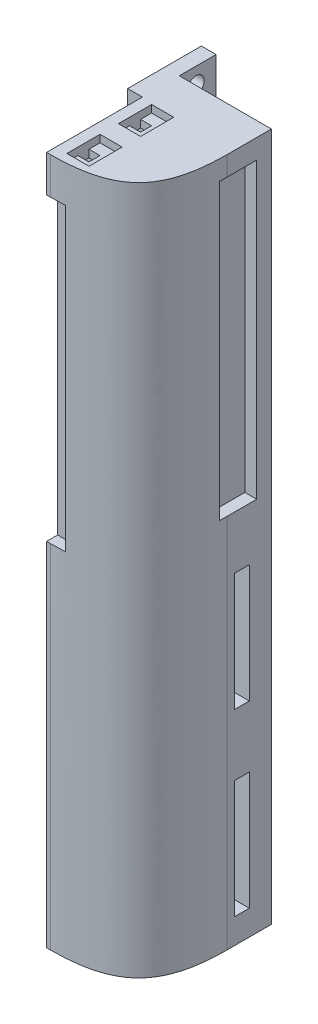
from build123d import *

# Parameters (mm, degrees)
SKETCH1_W                = 25
SKETCH1_H                = 36
BOSS_EXTRUDE1_DEPTH      = 186.9
FILLET1_SIZE             = 24
SKETCH2_W                = 5
SKETCH2_H                = 81.4
CUT_EXTRUDE1_DEPTH       = 3
BOSS_EXTRUDE3_DEPTH      = 10
BOSS_EXTRUDE3_DEPTH_BACK = 10
SKETCH6_W                = 4
SKETCH6_H                = 10
CUT_EXTRUDE2_REACH       = 196.65
SKETCH7_R                = 2.25
CHAMFER1_SIZE            = 4
SKETCH8_W                = 6
SKETCH8_H                = 4
CUT_EXTRUDE3_DEPTH       = 9
SKETCH9_W                = 3
SKETCH9_H                = 3
CUT_EXTRUDE4_DEPTH       = 10
BOSS_EXTRUDE4_DEPTH      = 4
SKETCH11_R               = 2
CUT_EXTRUDE5_DEPTH       = 5
SKETCH14_R               = 1.5
CUT_EXTRUDE6_DEPTH       = 4
SKETCH15_W               = 4
SKETCH15_H               = 32
CUT_EXTRUDE7_DEPTH       = 4
SKETCH16_W               = 10
SKETCH16_H               = 79.7
CUT_EXTRUDE8_DEPTH       = 3.2
SKETCH17_W               = 6
SKETCH17_H               = 9
CUT_EXTRUDE9_DEPTH       = 2


# Some blends are built 0.0001 mm under size
with BuildPart() as part:
    # Sketch1 → Boss-Extrude1 (new body)
    with BuildSketch(Plane(origin=(0, 0, 0), x_dir=(1, 0, 0), z_dir=(0, 1, 0))):
        with Locations((12.5, 18)):
            Rectangle(SKETCH1_W, SKETCH1_H)
    extrude(amount=BOSS_EXTRUDE1_DEPTH)

    # Fillet1
    # a fillet whose section is not a circle: 24 mm, written as the material it takes off along each edge
    with BuildSketch(Plane(origin=(25, -60, 0), x_dir=(-1, 0, 0), z_dir=(0, 1, 0))) as fillet1_piece_1:
        with BuildLine():
            Bezier((FILLET1_SIZE, 0), (0, 0), (0, -FILLET1_SIZE), weights=[1, 1.222222222, 1])
            Line((0, -FILLET1_SIZE), (0, 0))
            Line((0, 0), (FILLET1_SIZE, 0))
        make_face()
    extrude(amount=306.9, mode=Mode.SUBTRACT)

    # Sketch2 → Cut-Extrude1 (cut)
    with BuildSketch(Plane(origin=(0, 0, 0), x_dir=(-1, 0, 0), z_dir=(0, 0, -1))):
        with Locations((-2.5, 136.2)):
            Rectangle(SKETCH2_W, SKETCH2_H)
    extrude(amount=CUT_EXTRUDE1_DEPTH, mode=Mode.SUBTRACT)

    # Sketch6 → Boss-Extrude3 (add, two sides: drawn at the far end of the back side and taken through both)
    with BuildSketch(Plane(origin=(0, 0, -36), x_dir=(-1, 0, 0), z_dir=(0, 0, -1)).offset(-BOSS_EXTRUDE3_DEPTH_BACK)):
        with Locations((2, 181.9)):
            Rectangle(SKETCH6_W, SKETCH6_H)
        with Locations((2, 71.9)):
            Rectangle(SKETCH6_W, SKETCH6_H)
    extrude(amount=BOSS_EXTRUDE3_DEPTH + BOSS_EXTRUDE3_DEPTH_BACK)

    # Sketch7 → Cut-Extrude2 (cut, up to next)
    with BuildSketch(Plane.ZY.offset(4), mode=Mode.PRIVATE) as cut_extrude2_sk1:
        with Locations(Location((-40.5, 182.4, 0), (0, 0, 270))):
            Circle(SKETCH7_R)
    cut_extrude2_tool1 = extrude(cut_extrude2_sk1.sketch, amount=-CUT_EXTRUDE2_REACH, mode=Mode.PRIVATE) & part.part
    # Sketch7 → Cut-Extrude2 (cut, up to next)
    with BuildSketch(Plane.ZY.offset(4), mode=Mode.PRIVATE) as cut_extrude2_sk2:
        with Locations(Location((-40.5, 71.4, 0), (0, 0, 270))):
            Circle(SKETCH7_R)
    cut_extrude2_tool2 = extrude(cut_extrude2_sk2.sketch, amount=-CUT_EXTRUDE2_REACH, mode=Mode.PRIVATE) & part.part
    add(cut_extrude2_tool1.solids().sort_by_distance((-4, 182.4, -40.5))[0], mode=Mode.SUBTRACT)
    add(cut_extrude2_tool2.solids().sort_by_distance((-4, 71.4, -40.5))[0], mode=Mode.SUBTRACT)

    # Chamfer1
    chamfer1_edges = [part.edges().sort_by_distance(p)[0] for p in [
        (0, 71.9, -26),
    ]]
    chamfer(chamfer1_edges, length=CHAMFER1_SIZE - 0.0001)  # a hair under: the kernel refuses the full size

    # Sketch8 → Cut-Extrude3 (cut)
    with BuildSketch(Plane.ZY):
        with Locations((-7, 180.9)):
            Rectangle(SKETCH8_W, SKETCH8_H)
        with Locations((-21, 180.9)):
            Rectangle(SKETCH8_W, SKETCH8_H)
    extrude(amount=-CUT_EXTRUDE3_DEPTH, mode=Mode.SUBTRACT)

    # Sketch9 → Cut-Extrude4 (cut)
    with BuildSketch(Plane(origin=(0, 186.9, 0), x_dir=(1, 0, 0), z_dir=(0, 1, 0))):
        with Locations((4.5, 7)):
            Rectangle(SKETCH9_W, SKETCH9_H)
        with Locations((4.5, 21)):
            Rectangle(SKETCH9_W, SKETCH9_H)
    extrude(amount=-CUT_EXTRUDE4_DEPTH, mode=Mode.SUBTRACT)

    # Sketch10 → Boss-Extrude4 (add)
    with BuildSketch(Plane.XZ):
        Polygon((3, -5), (7, -5), (7, -29), (21, -29), (21, -33), (7, -33), (3, -33), align=None)
    extrude(amount=BOSS_EXTRUDE4_DEPTH)

    # Sketch11 → Cut-Extrude5 (cut)
    with BuildSketch(Plane.XZ):
        with Locations(Location((14, -22, 0), (0, 0, 270))):
            Circle(SKETCH11_R)
    extrude(amount=-CUT_EXTRUDE5_DEPTH, mode=Mode.SUBTRACT)

    # Sketch14 → Cut-Extrude6 (cut)
    with BuildSketch(Plane(origin=(0, 0, 0), x_dir=(-1, 0, 0), z_dir=(0, 1, 0))):
        with Locations(Location((-14, -11, 0), (0, 0, 90))):
            Circle(SKETCH14_R)
    extrude(amount=CUT_EXTRUDE6_DEPTH, mode=Mode.SUBTRACT)

    # Sketch15 → Cut-Extrude7 (cut)
    with BuildSketch(Plane(origin=(25, 0, 0), x_dir=(0, 0, -1), z_dir=(1, 0, 0))):
        with Locations((28, 71.5)):
            Rectangle(SKETCH15_W, SKETCH15_H)
        with Locations((28, 22.8)):
            Rectangle(SKETCH15_W, SKETCH15_H)
    extrude(amount=-CUT_EXTRUDE7_DEPTH, mode=Mode.SUBTRACT)

    # Sketch16 → Cut-Extrude8 (cut)
    with BuildSketch(Plane(origin=(25, 0, 0), x_dir=(0, 0, -1), z_dir=(1, 0, 0))):
        with Locations((27, 141.75)):
            Rectangle(SKETCH16_W, SKETCH16_H)
    extrude(amount=-CUT_EXTRUDE8_DEPTH, mode=Mode.SUBTRACT)

    # Sketch17 → Cut-Extrude9 (cut)
    with BuildSketch(Plane(origin=(0, 186.9, 0), x_dir=(1, 0, 0), z_dir=(0, 1, 0))):
        with Locations((6, 21)):
            Rectangle(SKETCH17_W, SKETCH17_H)
        with Locations((6, 7)):
            Rectangle(SKETCH17_W, SKETCH17_H)
    extrude(amount=-CUT_EXTRUDE9_DEPTH, mode=Mode.SUBTRACT)


solid = part.part
